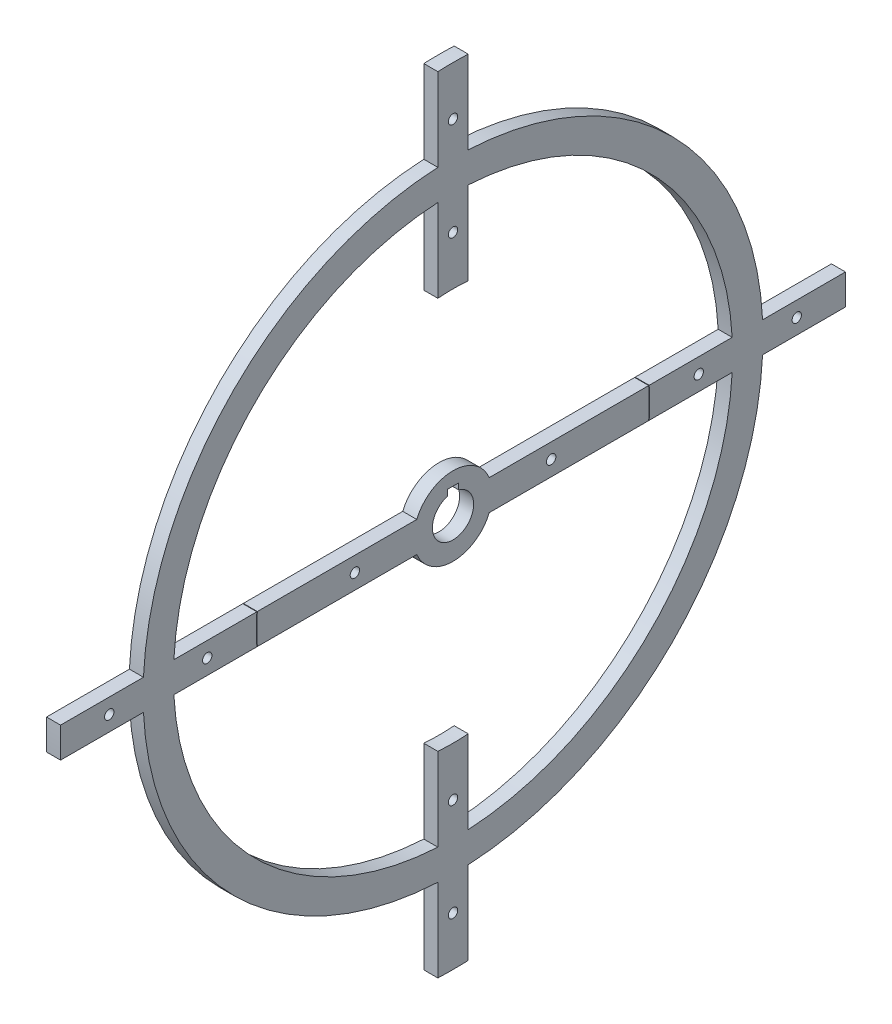
from build123d import *

# Parameters (mm, degrees)
SKETCH1_W           = 450
SKETCH1_H           = 450
BOSS_EXTRUDE1_DEPTH = 5
BOSS_EXTRUDE2_DEPTH = 7.48
BOSS_EXTRUDE3_DEPTH = 7.48
SKETCH6_W           = 450
SKETCH6_H           = 450
CUT_EXTRUDE1_DEPTH  = 5
SKETCH7_R           = 11
SKETCH7_R_2         = 2.5
CUT_EXTRUDE2_DEPTH  = 10


# Read off the part's stored shape, not the designer's step: Boss-Extrude2
with BuildPart() as part:
    # Sketch1 → Boss-Extrude1 (new body)
    with BuildSketch(Plane(origin=(0, 0, 0), x_dir=(0, 0, -1), z_dir=(1, 0, 0))):
        Rectangle(SKETCH1_W, SKETCH1_H)
    extrude(amount=BOSS_EXTRUDE1_DEPTH)

    # Boss-Extrude2 outline → Boss-Extrude2 (add)
    with BuildSketch(Plane(origin=(5, 0, 0), x_dir=(0, 0, -1), z_dir=(1, 0, 0))):
        with BuildLine():
            Line((-164.971757583, 8.09), (-209.152698388, 8.09))
            ThreePointArc((-209.152698388, 8.09), (-209.3091, 0), (-209.152698388, -8.09))
            Line((-209.152698388, -8.09), (-164.971757583, -8.09))
            ThreePointArc((-164.971757583, -8.09), (-116.792827049, -116.792827049), (-8.09, -164.971757583))
            Line((-8.09, -164.971757583), (-8.09, -209.152698388))
            ThreePointArc((-8.09, -209.152698388), (0, -209.3091), (8.09, -209.152698388))
            Line((8.09, -209.152698388), (8.09, -164.971757583))
            ThreePointArc((8.09, -164.971757583), (116.792827049, -116.792827049), (164.971757583, -8.09))
            Line((164.971757583, -8.09), (209.152698388, -8.09))
            ThreePointArc((209.152698388, -8.09), (209.3091, 0), (209.152698388, 8.09))
            Line((209.152698388, 8.09), (164.971757583, 8.09))
            ThreePointArc((164.971757583, 8.09), (116.792827049, 116.792827049), (8.09, 164.971757583))
            Line((8.09, 164.971757583), (8.09, 209.152698388))
            ThreePointArc((8.09, 209.152698388), (0, 209.3091), (-8.09, 209.152698388))
            Line((-8.09, 209.152698388), (-8.09, 164.971757583))
            ThreePointArc((-8.09, 164.971757583), (-116.792827049, 116.792827049), (-164.971757583, 8.09))
        make_face()
        with BuildLine():
            Line((148.770198629, 8.09), (104.538333308, 8.09))
            ThreePointArc((104.538333308, 8.09), (104.8509, 0), (104.538333308, -8.09))
            Line((104.538333308, -8.09), (148.770198629, -8.09))
            ThreePointArc((148.770198629, -8.09), (105.351839329, -105.351839329), (8.09, -148.770198629))
            Line((8.09, -148.770198629), (8.09, -104.538333308))
            ThreePointArc((8.09, -104.538333308), (0, -104.8509), (-8.09, -104.538333308))
            Line((-8.09, -104.538333308), (-8.09, -148.770198629))
            ThreePointArc((-8.09, -148.770198629), (-105.351839329, -105.351839329), (-148.770198629, -8.09))
            Line((-148.770198629, -8.09), (-104.538333308, -8.09))
            ThreePointArc((-104.538333308, -8.09), (-104.8509, 0), (-104.538333308, 8.09))
            Line((-104.538333308, 8.09), (-148.770198629, 8.09))
            ThreePointArc((-148.770198629, 8.09), (-105.351839329, 105.351839329), (-8.09, 148.770198629))
            Line((-8.09, 148.770198629), (-8.09, 104.538333308))
            ThreePointArc((-8.09, 104.538333308), (0, 104.8509), (8.09, 104.538333308))
            Line((8.09, 104.538333308), (8.09, 148.770198629))
            ThreePointArc((8.09, 148.770198629), (105.351839329, 105.351839329), (148.770198629, 8.09))
        make_face(mode=Mode.SUBTRACT)
    extrude(amount=BOSS_EXTRUDE2_DEPTH)

    # Sketch5 → Boss-Extrude3 (add)
    with BuildSketch(Plane(origin=(5, 0, 0), x_dir=(0, 0, -1), z_dir=(1, 0, 0))):
        with BuildLine():
            Line((-19.319547743, 8.09), (-104.275748565, 8.09))
            ThreePointArc((-104.275748565, 8.09), (-104.5891, 0), (-104.275748565, -8.09))
            Line((-104.275748565, -8.09), (-19.319547743, -8.09))
            ThreePointArc((-19.319547743, -8.09), (0, -20.945), (19.319547743, -8.09))
            Line((19.319547743, -8.09), (104.275748565, -8.09))
            ThreePointArc((104.275748565, -8.09), (104.5891, 0), (104.275748565, 8.09))
            Line((104.275748565, 8.09), (19.319547743, 8.09))
            ThreePointArc((19.319547743, 8.09), (0, 20.945), (-19.319547743, 8.09))
        make_face()
    extrude(amount=BOSS_EXTRUDE3_DEPTH)

    # Sketch6 → Cut-Extrude1 (cut)
    with BuildSketch(Plane.ZY):
        Rectangle(SKETCH6_W, SKETCH6_H)
    extrude(amount=-CUT_EXTRUDE1_DEPTH, mode=Mode.SUBTRACT)


with BuildPart() as cut_extrude1_piece_1:
    # of the separate pieces the step leaves, piece 1, a body of its own (cut_extrude1_pieces)
    add(part.part.solids().sort_by_distance((5, 209.152698388, 8.09))[0])


with BuildPart() as cut_extrude1_piece_2:
    # of the separate pieces the step leaves, piece 2, a body of its own (cut_extrude1_pieces)
    add(part.part.solids().sort_by_distance((5, 8.09, -104.275748565))[0])


with BuildPart() as cut_extrude2_tool:
    # Sketch7 → Cut-Extrude2 (new body)
    with BuildSketch(Plane(origin=(12.48, 0, 0), x_dir=(0, 0, -1), z_dir=(1, 0, 0))):
        Circle(SKETCH7_R)
        with Locations((-183.1891, 0)):
            Circle(SKETCH7_R_2)
        with Locations((-130.9659, 0)):
            Circle(SKETCH7_R_2)
        with Locations((0, -183.1891)):
            Circle(SKETCH7_R_2)
        with Locations((0, -130.9659)):
            Circle(SKETCH7_R_2)
        with Locations((183.1891, 0)):
            Circle(SKETCH7_R_2)
        with Locations((52.3, 0)):
            Circle(SKETCH7_R_2)
        with Locations((-52.295, 0)):
            Circle(SKETCH7_R_2)
        with Locations((0, 183.1891)):
            Circle(SKETCH7_R_2)
        with Locations((0, 130.9659)):
            Circle(SKETCH7_R_2)
        with BuildLine():
            Line((-3, 13.8), (-3, 10.583005244))
            ThreePointArc((-3, 10.583005244), (0, 11), (3, 10.583005244))
            Line((3, 10.583005244), (3, 13.8))
            Line((3, 13.8), (-3, 13.8))
        make_face()
        with Locations((130.9659, 0)):
            Circle(SKETCH7_R_2)
    extrude(amount=-CUT_EXTRUDE2_DEPTH)


with BuildPart() as cut_extrude1_piece_1_1:
    add(cut_extrude1_piece_1.part)

    # Cut-Extrude2: cut by cut_extrude2_tool
    add(cut_extrude2_tool.part, mode=Mode.SUBTRACT)


with BuildPart() as cut_extrude1_piece_2_1:
    add(cut_extrude1_piece_2.part)

    # Cut-Extrude2: cut by cut_extrude2_tool
    add(cut_extrude2_tool.part, mode=Mode.SUBTRACT)


solid = Compound([cut_extrude1_piece_1_1.part, cut_extrude1_piece_2_1.part])
